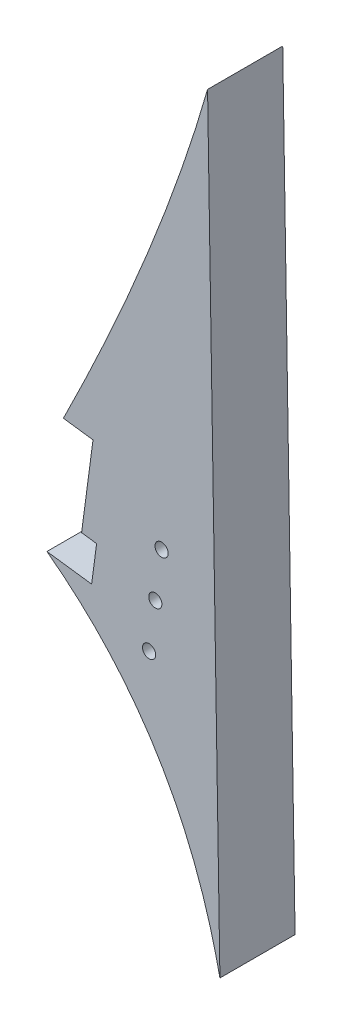
from build123d import *

# Parameters (mm, degrees)
BOSS_EXTRUDE1_DEPTH = 20
SKETCH2_R           = 1.75
CUT_EXTRUDE1_DEPTH  = 613.992726316


with BuildPart() as part:
    # Sketch1 → Boss-Extrude1 (new body)
    with BuildSketch(Plane.XY):
        with BuildLine():
            Line((273.434767303, -422.936084161), (270.394702546, -445.835167249))
            Line((270.394702546, -445.835167249), (274.394702546, -446.36620419))
            Line((274.394702546, -446.36620419), (273.067110194, -456.36620419))
            Line((273.067110194, -456.36620419), (261.171482616, -454.78694977))
            add(Edge.make_bspline(
                [(261.171482616, -454.78694977), (296.963881998, -481.467411972), (307.211379584, -530.076645967)],
                knots=[0, 0, 0, 1, 1, 1], degree=2))
            Line((307.211379584, -530.076645967), (306.524686262, -487.580325496))
            Line((306.524686262, -487.580325496), (304.787445338, -380.070401194))
            Line((304.787445338, -380.070401194), (303.928321947, -326.903169517))
            add(Edge.make_bspline(
                [(303.928321947, -326.903169517), (291.919284229, -369.026747001), (265.55288805, -421.8896919)],
                knots=[0, 0, 0, 1, 1, 1], degree=2))
            Line((265.55288805, -421.8896919), (273.434767303, -422.936084161))
        make_face()
    extrude(amount=BOSS_EXTRUDE1_DEPTH)

    # Sketch2 → Cut-Extrude1 (cut, through all)
    with BuildSketch(Plane.XY.offset(20)):
        with Locations((288.352935212, -464.179893051)):
            Circle(SKETCH2_R)
        with Locations((290.016681941, -451.647832837)):
            Circle(SKETCH2_R)
        with Locations((291.68042867, -439.115772622)):
            Circle(SKETCH2_R)
    extrude(amount=-CUT_EXTRUDE1_DEPTH, mode=Mode.SUBTRACT)


solid = part.part
